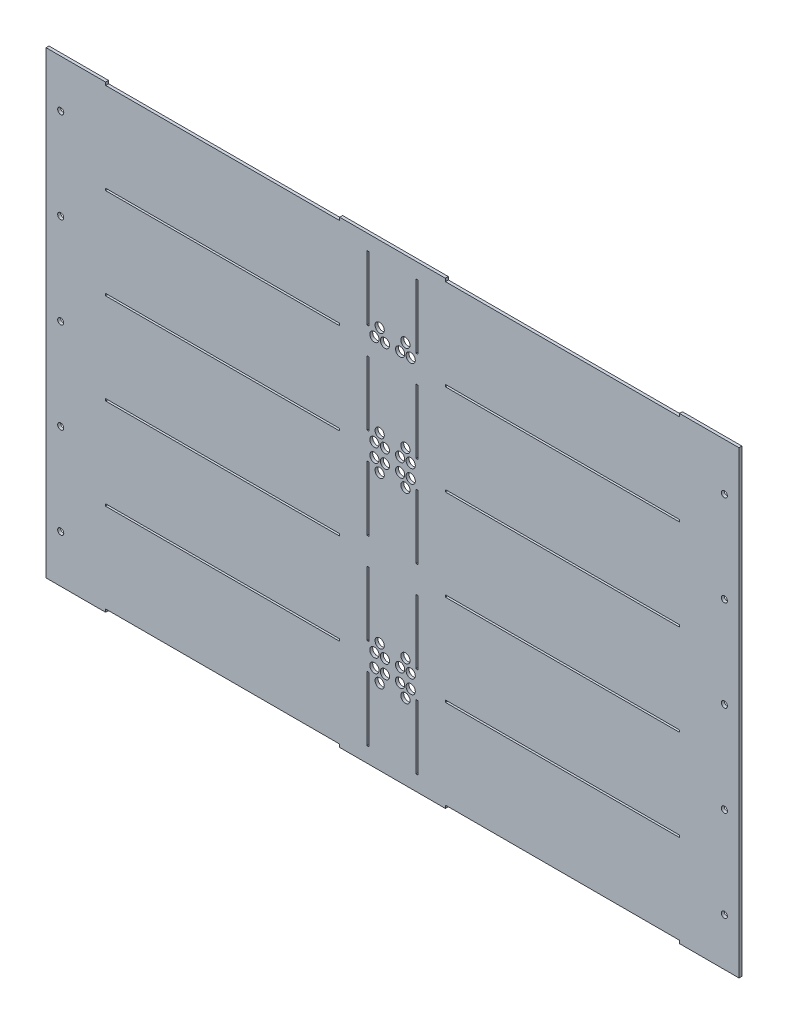
from build123d import *

# Parameters (mm, degrees)
MASTER_SKETCH_W           = 688.4416
MASTER_SKETCH_H           = 498.348
BOSS_EXTRUDE1_DEPTH       = 3.175
SKETCH1_W                 = 31.75
SKETCH1_H                 = 498.348
BOSS_EXTRUDE2_DEPTH       = 3.175
M6_CLEARANCE_HOLE1_D      = 6.6
SKETCH5_W                 = 2.286
SKETCH5_H                 = 69.85
CUT_EXTRUDE1_DEPTH        = 452.056321709
LPATTERN1_COUNT           = 5
LPATTERN1_PITCH           = 98.8568
SKETCH6_W                 = 254
SKETCH6_H                 = 3.175
CUT_EXTRUDE2_DEPTH        = 452.056321709
SKETCH7_W                 = 254
SKETCH7_H                 = 2.286
CUT_EXTRUDE3_DEPTH        = 452.056321709
LPATTERN2_COUNT           = 4
LPATTERN2_PITCH           = 98.8568
SKETCH8_R                 = 5
CUT_EXTRUDE4_DEPTH        = 452.056321709
LPATTERN3_COUNT           = 2
LPATTERN3_PITCH           = 197.7136
LPATTERN3_COPY_1_SKETCH_R = 5
LPATTERN3_COPY_1_DEPTH    = 452.056321709
SKETCH9_R                 = 5
CUT_EXTRUDE5_DEPTH        = 452.056321709
LPATTERN4_COPY_1_SKETCH_R = 5
LPATTERN4_COPY_1_DEPTH    = 452.056321709
LPATTERN4_COPY_2_SKETCH_R = 5
LPATTERN4_COPY_2_DEPTH    = 452.056321709
LPATTERN4_COPY_3_SKETCH_R = 5
LPATTERN4_COPY_3_DEPTH    = 452.056321709
LPATTERN4_COPY_4_SKETCH_R = 5
LPATTERN4_COPY_4_DEPTH    = 452.056321709


with BuildPart() as part:
    # Master Sketch → Boss-Extrude1 (new body)
    with BuildSketch(Plane.XY):
        Rectangle(MASTER_SKETCH_W, MASTER_SKETCH_H)
    extrude(amount=BOSS_EXTRUDE1_DEPTH)

    # Sketch1 → Boss-Extrude2 (add)
    with BuildSketch(Plane.XY.offset(3.175)):
        with Locations((-360.0958, 0)):
            Rectangle(SKETCH1_W, SKETCH1_H)
    boss_extrude2 = extrude(amount=-BOSS_EXTRUDE2_DEPTH)

    # M6 Clearance Hole1 (through all)
    with Locations(Plane.XY.offset(3.175)):
        with Locations((-360.0958, -197.612), (-360.0958, -98.806), (-360.0958, 0), (-360.0958, 98.806), (-360.0958, 197.612)):
            m6_clearance_hole1 = Hole(M6_CLEARANCE_HOLE1_D / 2)

    # Mirror1: Boss-Extrude2, M6 Clearance Hole1 across plane
    add(boss_extrude2.mirror(Plane(origin=(0, 0, 0), x_dir=(0, 0, 1), z_dir=(1, 0, 0))))
    add(m6_clearance_hole1.mirror(Plane(origin=(0, 0, 0), x_dir=(0, 0, 1), z_dir=(1, 0, 0))), mode=Mode.SUBTRACT)

    # Sketch5 → Cut-Extrude1 (cut, through all)
    with BuildSketch(Plane.XY.offset(3.175)):
        with Locations((26.543, 197.7136)):
            Rectangle(SKETCH5_W, SKETCH5_H)
        with Locations((-26.543, 197.7136)):
            Rectangle(SKETCH5_W, SKETCH5_H)
    cut_extrude1 = extrude(amount=-CUT_EXTRUDE1_DEPTH, mode=Mode.SUBTRACT)

    # LPattern1: Cut-Extrude1 ×5
    with Locations(*[(0, -i * LPATTERN1_PITCH, 0) for i in range(1, LPATTERN1_COUNT)]):
        add(cut_extrude1, mode=Mode.SUBTRACT)

    # Sketch6 → Cut-Extrude2 (cut, through all)
    with BuildSketch(Plane.XY.offset(3.175)):
        with Locations((-184.3659, 247.5865)):
            Rectangle(SKETCH6_W, SKETCH6_H)
        with Locations((184.3659, 247.5865)):
            Rectangle(SKETCH6_W, SKETCH6_H)
    cut_extrude2 = extrude(amount=-CUT_EXTRUDE2_DEPTH, mode=Mode.SUBTRACT)

    # Mirror2: Cut-Extrude2 across plane
    add(cut_extrude2.mirror(Plane.ZX), mode=Mode.SUBTRACT)

    # Sketch7 → Cut-Extrude3 (cut, through all)
    with BuildSketch(Plane.XY.offset(3.175)):
        with Locations((-184.3659, 148.2852)):
            Rectangle(SKETCH7_W, SKETCH7_H)
        with Locations((184.3659, 148.2852)):
            Rectangle(SKETCH7_W, SKETCH7_H)
    cut_extrude3 = extrude(amount=-CUT_EXTRUDE3_DEPTH, mode=Mode.SUBTRACT)

    # LPattern2: Cut-Extrude3 ×4
    with Locations(*[(0, -i * LPATTERN2_PITCH, 0) for i in range(1, LPATTERN2_COUNT)]):
        add(cut_extrude3, mode=Mode.SUBTRACT)

    # Sketch8 → Cut-Extrude4 (cut, through all)
    with BuildSketch(Plane(origin=(0, 0, 0), x_dir=(-1, 0, 0), z_dir=(0, 0, -1))):
        with Locations((19.685, -155.591933333)):
            Circle(SKETCH8_R)
        with Locations((13.97, -167.021933333)):
            Circle(SKETCH8_R)
        with Locations((8.255, -155.591933333)):
            Circle(SKETCH8_R)
    cut_extrude4 = extrude(amount=-CUT_EXTRUDE4_DEPTH, mode=Mode.SUBTRACT)

    # Mirror3: Cut-Extrude4 across plane
    add(cut_extrude4.mirror(Plane(origin=(0, 0, 0), x_dir=(0, 0, 1), z_dir=(1, 0, 0))), mode=Mode.SUBTRACT)

    # LPattern3: Cut-Extrude4 ×2
    with Locations(*[(0, i * LPATTERN3_PITCH, 0) for i in range(1, LPATTERN3_COUNT)]):
        add(cut_extrude4, mode=Mode.SUBTRACT)

    # LPattern3 copy 1 sketch → LPattern3 copy 1 (cut, through all)
    with BuildSketch(Plane(origin=(0, 197.7136, 0), x_dir=(1, 0, 0), z_dir=(0, 0, -1))):
        with Locations((19.685, 155.591933333)):
            Circle(LPATTERN3_COPY_1_SKETCH_R)
        with Locations((13.97, 167.021933333)):
            Circle(LPATTERN3_COPY_1_SKETCH_R)
        with Locations((8.255, 155.591933333)):
            Circle(LPATTERN3_COPY_1_SKETCH_R)
    extrude(amount=-LPATTERN3_COPY_1_DEPTH, mode=Mode.SUBTRACT)

    # Sketch9 → Cut-Extrude5 (cut, through all)
    with BuildSketch(Plane(origin=(0, 0, 0), x_dir=(-1, 0, 0), z_dir=(0, 0, -1))):
        with Locations((8.255, -140.978466667)):
            Circle(SKETCH9_R)
        with Locations((13.97, -129.548466667)):
            Circle(SKETCH9_R)
        with Locations((19.685, -140.978466667)):
            Circle(SKETCH9_R)
    cut_extrude5 = extrude(amount=-CUT_EXTRUDE5_DEPTH, mode=Mode.SUBTRACT)

    # Mirror4: Cut-Extrude5 across plane
    add(cut_extrude5.mirror(Plane(origin=(0, 0, 0), x_dir=(0, 0, 1), z_dir=(1, 0, 0))), mode=Mode.SUBTRACT)

    # LPattern4 copy 1 sketch → LPattern4 copy 1 (cut, through all)
    with BuildSketch(Plane(origin=(0, 197.7136, 0), x_dir=(1, 0, 0), z_dir=(0, 0, -1))):
        with Locations((8.255, 140.978466667)):
            Circle(LPATTERN4_COPY_1_SKETCH_R)
        with Locations((13.97, 129.548466667)):
            Circle(LPATTERN4_COPY_1_SKETCH_R)
        with Locations((19.685, 140.978466667)):
            Circle(LPATTERN4_COPY_1_SKETCH_R)
    extrude(amount=-LPATTERN4_COPY_1_DEPTH, mode=Mode.SUBTRACT)

    # LPattern4 copy 2 sketch → LPattern4 copy 2 (cut, through all)
    with BuildSketch(Plane(origin=(0, 296.5704, 0), x_dir=(1, 0, 0), z_dir=(0, 0, -1))):
        with Locations((8.255, 140.978466667)):
            Circle(LPATTERN4_COPY_2_SKETCH_R)
        with Locations((13.97, 129.548466667)):
            Circle(LPATTERN4_COPY_2_SKETCH_R)
        with Locations((19.685, 140.978466667)):
            Circle(LPATTERN4_COPY_2_SKETCH_R)
    extrude(amount=-LPATTERN4_COPY_2_DEPTH, mode=Mode.SUBTRACT)

    # LPattern4 copy 3 sketch → LPattern4 copy 3 (cut, through all)
    with BuildSketch(Plane(origin=(0, 197.7136, 0), x_dir=(-1, 0, 0), z_dir=(0, 0, -1))):
        with Locations((8.255, -140.978466667)):
            Circle(LPATTERN4_COPY_3_SKETCH_R)
        with Locations((13.97, -129.548466667)):
            Circle(LPATTERN4_COPY_3_SKETCH_R)
        with Locations((19.685, -140.978466667)):
            Circle(LPATTERN4_COPY_3_SKETCH_R)
    extrude(amount=-LPATTERN4_COPY_3_DEPTH, mode=Mode.SUBTRACT)

    # LPattern4 copy 4 sketch → LPattern4 copy 4 (cut, through all)
    with BuildSketch(Plane(origin=(0, 296.5704, 0), x_dir=(-1, 0, 0), z_dir=(0, 0, -1))):
        with Locations((8.255, -140.978466667)):
            Circle(LPATTERN4_COPY_4_SKETCH_R)
        with Locations((13.97, -129.548466667)):
            Circle(LPATTERN4_COPY_4_SKETCH_R)
        with Locations((19.685, -140.978466667)):
            Circle(LPATTERN4_COPY_4_SKETCH_R)
    extrude(amount=-LPATTERN4_COPY_4_DEPTH, mode=Mode.SUBTRACT)


solid = part.part
